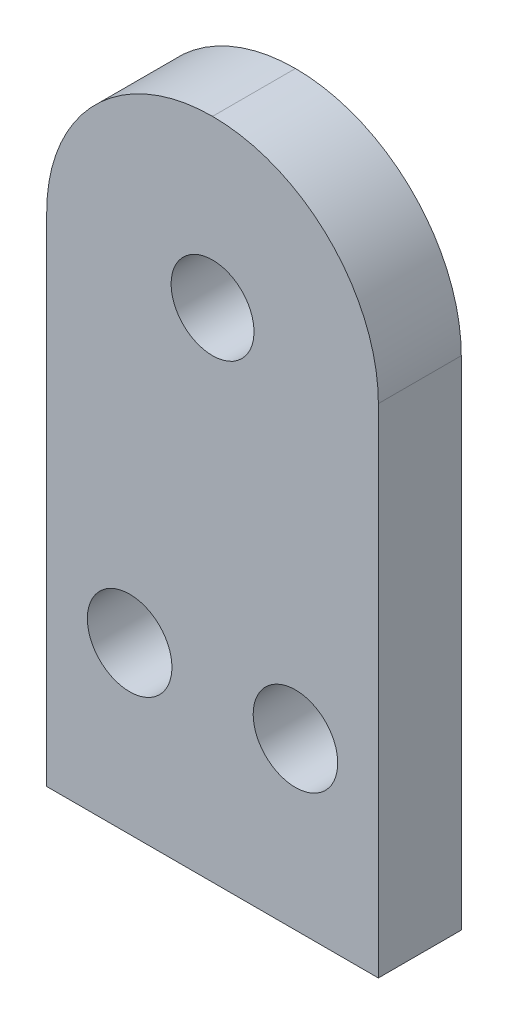
from build123d import *

# Parameters (mm, degrees)
SKETCH1_W           = 20
SKETCH1_H           = 40
BOSS_EXTRUDE1_DEPTH = 5
FILLET2_R           = 10
SKETCH2_R           = 2.5
CUT_EXTRUDE1_DEPTH  = 23.912878475
SKETCH3_R           = 2.55
CUT_EXTRUDE2_DEPTH  = 5


with BuildPart() as part:
    # Sketch1 → Boss-Extrude1 (new body)
    with BuildSketch(Plane.XY):
        Rectangle(SKETCH1_W, SKETCH1_H)
    extrude(amount=BOSS_EXTRUDE1_DEPTH)

    # Fillet2
    fillet2_edges = [part.edges().sort_by_distance(p)[0] for p in [
        (-10, 20, 2.5),
        (10, 20, 2.5),
    ]]
    fillet(fillet2_edges, radius=FILLET2_R - 0.0001)  # a hair under: the kernel refuses the full size

    # Sketch2 → Cut-Extrude1 (cut, through all)
    with BuildSketch(Plane(origin=(0, 0, 0), x_dir=(-1, 0, 0), z_dir=(0, 0, -1))):
        with Locations((0, 10)):
            Circle(SKETCH2_R)
    extrude(amount=-CUT_EXTRUDE1_DEPTH, mode=Mode.SUBTRACT)

    # Sketch3 → Cut-Extrude2 (cut)
    with BuildSketch(Plane(origin=(0, 0, 0), x_dir=(-1, 0, 0), z_dir=(0, 0, -1))):
        with Locations((-5, -10)):
            Circle(SKETCH3_R)
        with Locations((5, -10)):
            Circle(SKETCH3_R)
    extrude(amount=-CUT_EXTRUDE2_DEPTH, mode=Mode.SUBTRACT)


solid = part.part
